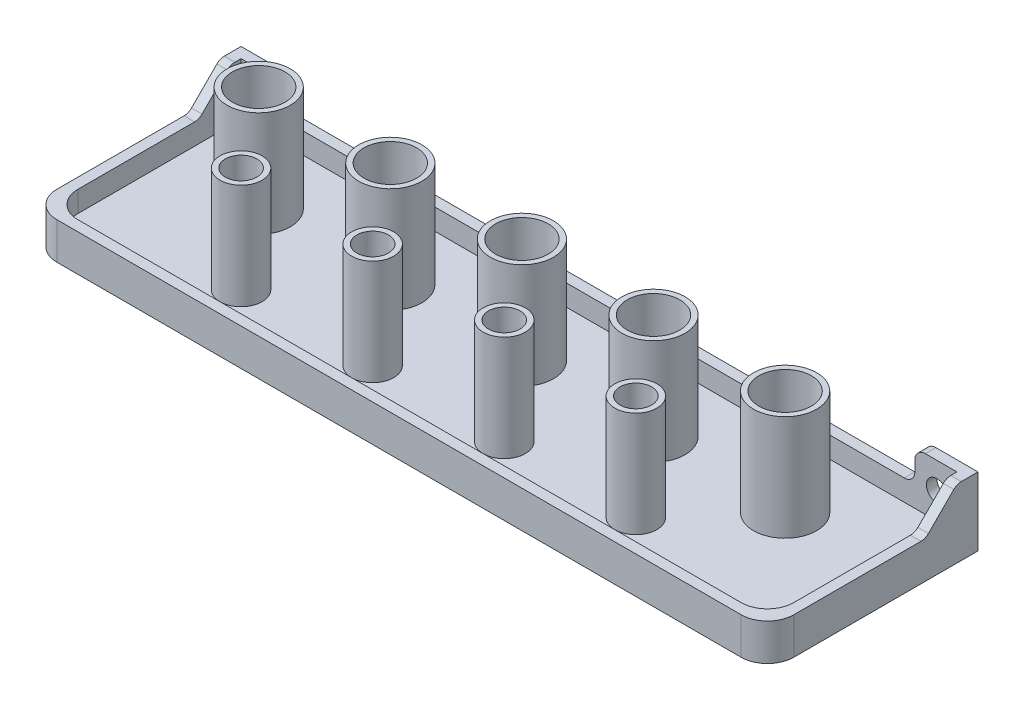
from build123d import *

# Parameters (mm, degrees)
ESQUISSE1_W                      = 140
ESQUISSE1_H                      = 40
BOSS_EXTRU_1_DEPTH               = 3
ESQUISSE2_R                      = 6
ESQUISSE2_R_2                    = 5
BOSS_EXTRU_2_DEPTH               = 20
ESQUISSE7_R                      = 5
ENL_V_MAT_EXTRU_3_DEPTH          = 76.498344353
R_P_TITION_LIN_AIRE3_OUTLINE_R   = 5
R_P_TITION_LIN_AIRE3_DEPTH       = 3
R_P_TITION_START                 = 3
R_P_TITION_LIN_AIRE3_2_OUTLINE_R = 6
R_P_TITION_LIN_AIRE3_2_DEPTH     = 20
ESQUISSE8_R                      = 5
ENL_V_MAT_EXTRU_4_DEPTH          = 77.347887987
R_P_TITION_LIN_AIRE4_COUNT       = 4
R_P_TITION_LIN_AIRE4_PITCH       = 25
ESQUISSE9_R                      = 4
BOSS_EXTRU_4_DEPTH               = 20
ESQUISSE12_R                     = 3
ENL_V_MAT_EXTRU_6_DEPTH          = 77.347887987
R_P_TITION_LIN_AIRE5_COUNT       = 4
R_P_TITION_LIN_AIRE5_PITCH       = 25
BOSS_EXTRU_5_DEPTH               = 10
CHANFREIN1_SIZE                  = 6
ESQUISSE15_R                     = 2
ENL_V_MAT_EXTRU_7_DEPTH          = 83.903558428
ESQUISSE18_W                     = 60
ESQUISSE18_H                     = 2
BOSS_EXTRU_6_DEPTH               = 4
CONG_2_R                         = 5
CONG_3_R                         = 2
SYM_TRIE1_OUTLINE_W              = 4
SYM_TRIE1_OUTLINE_H              = 2
SYM_TRIE1_DEPTH                  = 62.191181732
SYM_TRIE1_START                  = 68
SYM_TRIE1_2_DEPTH                = 2
SYM_TRIE1_START_2                = 66.191181932
SYM_TRIE1_3_OUTLINE_W            = 10
SYM_TRIE1_3_OUTLINE_H            = 2
SYM_TRIE1_3_OUTLINE_W_2          = 4
SYM_TRIE1_3_DEPTH                = 1.808818068
SYM_TRIE1_START_3                = 62
SYM_TRIE1_4_OUTLINE_W            = 4
SYM_TRIE1_4_OUTLINE_H            = 2
SYM_TRIE1_4_DEPTH                = 6
SYM_TRIE1_5_OUTLINE_W            = 6
SYM_TRIE1_5_OUTLINE_H            = 2
SYM_TRIE1_5_DEPTH                = 0.191181732
SYM_TRIE1_START_4                = -20
SYM_TRIE1_6_DEPTH                = 2
SYM_TRIE1_START_5                = 2
SYM_TRIE1_7_DEPTH                = 5
CONG_4_R                         = 5


with BuildPart() as part:
    # Esquisse1 → Boss.-Extru.1 (new body)
    with BuildSketch(Plane(origin=(0, 0, 0), x_dir=(1, 0, 0), z_dir=(0, 1, 0))):
        Rectangle(ESQUISSE1_W, ESQUISSE1_H)
    extrude(amount=BOSS_EXTRU_1_DEPTH)

    # Esquisse2 → Boss.-Extru.2 (add)
    with BuildSketch(Plane(origin=(0, 3, 0), x_dir=(1, 0, 0), z_dir=(0, 1, 0))):
        with Locations(Location((-51.645903367, 5, 0), (0, 0, 270))):
            Circle(ESQUISSE2_R)
        with Locations(Location((-51.645903367, 5, 0), (0, 0, 270))):
            Circle(ESQUISSE2_R_2, mode=Mode.SUBTRACT)
    extrude(amount=BOSS_EXTRU_2_DEPTH)

    # Esquisse7 → Enlèv. mat.-Extru.3 (cut, through all)
    with BuildSketch(Plane(origin=(0, 3, 0), x_dir=(1, 0, 0), z_dir=(0, 1, 0))):
        with Locations(Location((-51.645903367, 5, 0), (0, 0, 270))):
            Circle(ESQUISSE7_R)
    extrude(amount=-ENL_V_MAT_EXTRU_3_DEPTH, mode=Mode.SUBTRACT)

    # Répétition linéaire3: read off the stored shape, not the designer's step
    # Répétition linéaire3 outline → Répétition linéaire3 (cut)
    with BuildSketch(Plane(origin=(0, 0, 0), x_dir=(1, 0, 0), z_dir=(0, 1, 0))):
        with Locations((-26.645903367, 5)):
            Circle(R_P_TITION_LIN_AIRE3_OUTLINE_R)
        with Locations((48.354096633, 5)):
            Circle(R_P_TITION_LIN_AIRE3_OUTLINE_R)
        with Locations((23.354096633, 5)):
            Circle(R_P_TITION_LIN_AIRE3_OUTLINE_R)
        with Locations((-1.645903367, 5)):
            Circle(R_P_TITION_LIN_AIRE3_OUTLINE_R)
    extrude(amount=R_P_TITION_LIN_AIRE3_DEPTH, mode=Mode.SUBTRACT)

    # R_p_tition lin_aire3 2 outline → R_p_tition lin_aire3 2 (add)
    with BuildSketch(Plane(origin=(0, 0, 0), x_dir=(1, 0, 0), z_dir=(0, 1, 0)).offset(R_P_TITION_START)):
        with Locations((48.354096633, 5)):
            Circle(R_P_TITION_LIN_AIRE3_2_OUTLINE_R)
        with Locations((23.354096633, 5)):
            Circle(R_P_TITION_LIN_AIRE3_2_OUTLINE_R)
        with Locations((-1.645903367, 5)):
            Circle(R_P_TITION_LIN_AIRE3_2_OUTLINE_R)
        with Locations((-26.645903367, 5)):
            Circle(R_P_TITION_LIN_AIRE3_2_OUTLINE_R)
    extrude(amount=R_P_TITION_LIN_AIRE3_2_DEPTH)

    # Esquisse8 → Enlèv. mat.-Extru.4 (cut, through all)
    with BuildSketch(Plane(origin=(0, 23, 0), x_dir=(1, 0, 0), z_dir=(0, 1, 0))):
        with Locations(Location((-26.645903367, 5, 0), (0, 0, 270))):
            Circle(ESQUISSE8_R)
    enl_v_mat_extru_4 = extrude(amount=-ENL_V_MAT_EXTRU_4_DEPTH, mode=Mode.SUBTRACT)

    # Répétition linéaire4: Enlèv. mat.-Extru.4 ×4
    with Locations(*[(i * R_P_TITION_LIN_AIRE4_PITCH, 0, 0) for i in range(1, R_P_TITION_LIN_AIRE4_COUNT)]):
        add(enl_v_mat_extru_4, mode=Mode.SUBTRACT)

    # Esquisse9 → Boss.-Extru.4 (add)
    with BuildSketch(Plane(origin=(0, 3, 0), x_dir=(1, 0, 0), z_dir=(0, 1, 0))):
        with Locations(Location((-40, -10.001459341, 0), (0, 0, 270))):
            Circle(ESQUISSE9_R)
    boss_extru_4 = extrude(amount=BOSS_EXTRU_4_DEPTH)

    # Esquisse12 → Enlèv. mat.-Extru.6 (cut, through all)
    with BuildSketch(Plane(origin=(0, 23, 0), x_dir=(1, 0, 0), z_dir=(0, 1, 0))):
        with Locations(Location((-40, -10.001459341, 0), (0, 0, 270))):
            Circle(ESQUISSE12_R)
    enl_v_mat_extru_6 = extrude(amount=-ENL_V_MAT_EXTRU_6_DEPTH, mode=Mode.SUBTRACT)

    # Répétition linéaire5: Boss.-Extru.4, Enlèv. mat.-Extru.6 ×4
    with Locations(*[(i * R_P_TITION_LIN_AIRE5_PITCH, 0, 0) for i in range(1, R_P_TITION_LIN_AIRE5_COUNT)]):
        add(boss_extru_4)
        add(enl_v_mat_extru_6, mode=Mode.SUBTRACT)

    # Esquisse13 → Boss.-Extru.5 (add)
    with BuildSketch(Plane(origin=(0, 3, 0), x_dir=(1, 0, 0), z_dir=(0, 1, 0))):
        Polygon((-70, 20), (-60, 20), (-60, 18), (-68, 18), (-68, 10), (-70, 10), align=None)
    extrude(amount=BOSS_EXTRU_5_DEPTH)

    # Chanfrein1
    chanfrein1_edges = [part.edges().sort_by_distance(p)[0] for p in [
        (-69, 13, -10),
    ]]
    chamfer(chanfrein1_edges, length=CHANFREIN1_SIZE)

    # Esquisse15 → Enlèv. mat.-Extru.7 (cut, through all)
    with BuildSketch(Plane.XY.offset(-18)):
        with Locations((-64.191181832, 8)):
            Circle(ESQUISSE15_R)
    extrude(amount=-ENL_V_MAT_EXTRU_7_DEPTH, mode=Mode.SUBTRACT)

    # Esquisse18 → Boss.-Extru.6 (add)
    with BuildSketch(Plane(origin=(0, 3, 0), x_dir=(1, 0, 0), z_dir=(0, 1, 0))):
        Polygon((-68, 10), (-68, -18), (0, -18), (0, -20), (-70, -20), (-70, 10), align=None)
        with Locations((-30, 19)):
            Rectangle(ESQUISSE18_W, ESQUISSE18_H)
    extrude(amount=BOSS_EXTRU_6_DEPTH)

    # Congé2
    cong_2_edges = [part.edges().sort_by_distance(p)[0] for p in [
        (-68, 5, 18),
        (-70, 3.5, 20),
    ]]
    fillet(cong_2_edges, radius=CONG_2_R)

    # Congé3
    cong_3_edges = [part.edges().sort_by_distance(p)[0] for p in [
        (-60, 13, -19),
        (-69, 13, -16),
        (-69, 7, -10),
        (-60, 7, -19),
    ]]
    fillet(cong_3_edges, radius=CONG_3_R)

    # Symétrie1: read off the stored shape, not the designer's step
    # Symétrie1 outline → Symétrie1 (add)
    with BuildSketch(Plane.YZ):
        with Locations((5, -19)):
            Rectangle(SYM_TRIE1_OUTLINE_W, SYM_TRIE1_OUTLINE_H)
        with Locations((5, 19)):
            Rectangle(SYM_TRIE1_OUTLINE_W, SYM_TRIE1_OUTLINE_H)
    extrude(amount=SYM_TRIE1_DEPTH)

    # Sym_trie1 2 outline → Sym_trie1 2 (add)
    with BuildSketch(Plane.YZ.offset(SYM_TRIE1_START)):
        with BuildLine():
            Line((13, -20), (13, -16.828427125))
            ThreePointArc((13, -16.828427125), (12.847759065, -16.06306026), (12.414213562, -15.414213562))
            Line((12.414213562, -15.414213562), (7.585786438, -10.585786438))
            ThreePointArc((7.585786438, -10.585786438), (7.152240935, -9.93693974), (7, -9.171572875))
            Line((7, -9.171572875), (7, 20))
            Line((7, 20), (3, 20))
            Line((3, 20), (3, -20))
            Line((3, -20), (13, -20))
        make_face()
    extrude(amount=SYM_TRIE1_2_DEPTH)

    # Sym_trie1 3 outline → Sym_trie1 3 (add)
    with BuildSketch(Plane.YZ.offset(SYM_TRIE1_START_2)):
        with Locations((8, -19)):
            Rectangle(SYM_TRIE1_3_OUTLINE_W, SYM_TRIE1_3_OUTLINE_H)
        with Locations((5, 19)):
            Rectangle(SYM_TRIE1_3_OUTLINE_W_2, SYM_TRIE1_3_OUTLINE_H)
    extrude(amount=SYM_TRIE1_3_DEPTH)

    # Sym_trie1 4 outline → Sym_trie1 4 (add)
    with BuildSketch(Plane.YZ.offset(SYM_TRIE1_START_3)):
        with Locations((5, 19)):
            Rectangle(SYM_TRIE1_4_OUTLINE_W, SYM_TRIE1_4_OUTLINE_H)
    extrude(amount=SYM_TRIE1_4_DEPTH)

    # Sym_trie1 5 outline → Sym_trie1 5 (add)
    with BuildSketch(Plane.YZ.offset(SYM_TRIE1_START_3)):
        with Locations((10, -19)):
            Rectangle(SYM_TRIE1_5_OUTLINE_W, SYM_TRIE1_5_OUTLINE_H)
    extrude(amount=SYM_TRIE1_5_DEPTH)

    # Sym_trie1 6 outline → Sym_trie1 6 (add)
    with BuildSketch(Plane.XY.offset(SYM_TRIE1_START_4)):
        with BuildLine():
            ThreePointArc((62, 13), (60.585786438, 12.414213562), (60, 11))
            Line((60, 11), (60, 9))
            ThreePointArc((60, 9), (59.414213562, 7.585786438), (58, 7))
            Line((58, 7), (62, 7))
            Line((62, 7), (62, 13))
        make_face()
        with BuildLine():
            Line((66.191181932, 13), (62.191181732, 13))
            Line((62.191181732, 13), (62.191181832, 8))
            ThreePointArc((62.191181832, 8), (64.191181832, 10), (66.191181832, 8))
            Line((66.191181832, 8), (66.191181932, 13))
        make_face()
        with BuildLine():
            Line((62.191181832, 8), (62.191181732, 3))
            Line((62.191181732, 3), (66.191181932, 3))
            Line((66.191181932, 3), (66.191181832, 8))
            ThreePointArc((66.191181832, 8), (64.191181832, 6), (62.191181832, 8))
        make_face()
    extrude(amount=SYM_TRIE1_6_DEPTH)

    # Sym_trie1 7 outline → Sym_trie1 7 (add)
    with BuildSketch(Plane(origin=(0, 0, 0), x_dir=(1, 0, 0), z_dir=(0, 1, 0)).offset(SYM_TRIE1_START_5)):
        with BuildLine():
            Line((68, -18), (68, -13))
            ThreePointArc((68, -13), (66.535533906, -16.535533906), (63, -18))
            Line((63, -18), (68, -18))
        make_face()
    extrude(amount=SYM_TRIE1_7_DEPTH)

    # Congé4
    cong_4_edges = [part.edges().sort_by_distance(p)[0] for p in [
        (70, 3.5, 20),
    ]]
    fillet(cong_4_edges, radius=CONG_4_R)


solid = part.part
